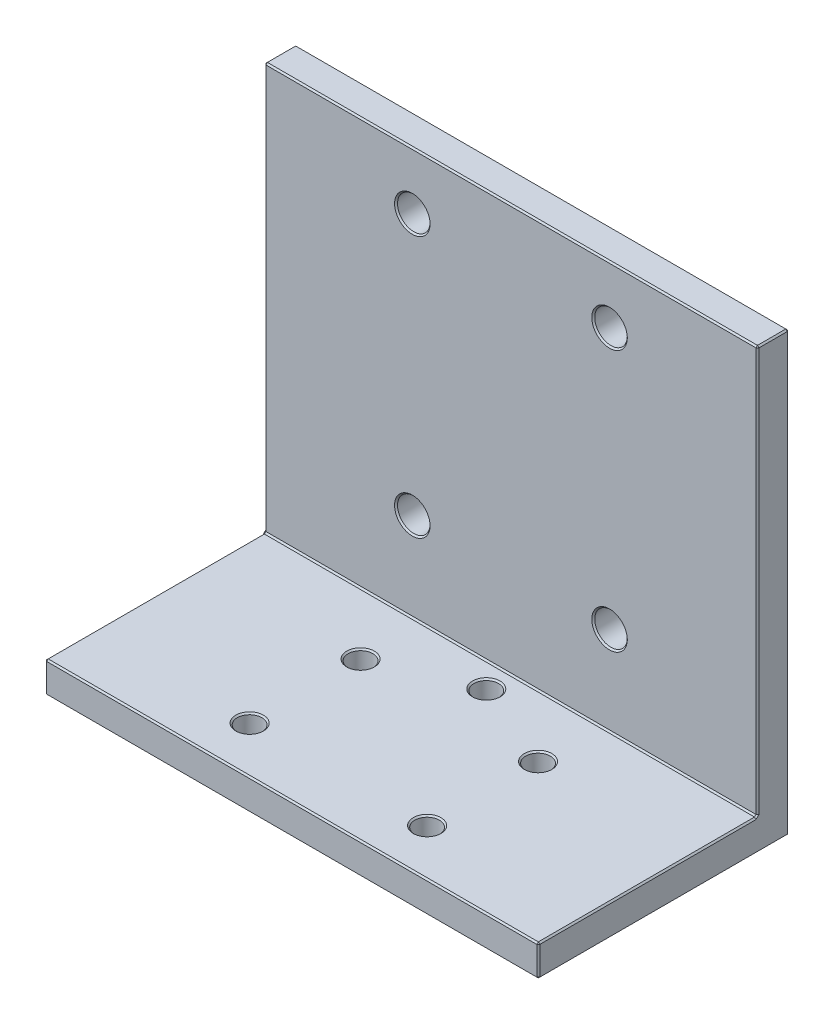
from build123d import *

# Parameters (mm, degrees)
BOSS_EXTRUDE1_DEPTH = 50
SKETCH2_R           = 3.3
CUT_EXTRUDE1_DEPTH  = 100
SKETCH3_R           = 2.5
CUT_EXTRUDE2_DEPTH  = 100
CHAMFER1_SIZE       = 0.3


with BuildPart() as part:
    # Sketch1 → Boss-Extrude1 (new, symmetric)
    with BuildSketch(Plane(origin=(0, 0, 0), x_dir=(0, 0, -1), z_dir=(1, 0, 0))):
        Polygon((0, 0), (0, 88.9), (-6.35, 88.9), (-6.35, 6.35), (-50.8, 6.35), (-50.8, 0), align=None)
    extrude(amount=BOSS_EXTRUDE1_DEPTH, both=True)

    # Sketch2 → Cut-Extrude1 (cut)
    with BuildSketch(Plane.XY.offset(6.35)):
        with Locations((-20, 77.3)):
            Circle(SKETCH2_R)
        with Locations((20, 77.3)):
            Circle(SKETCH2_R)
        with Locations((20, 24.3)):
            Circle(SKETCH2_R)
        with Locations((-20, 24.3)):
            Circle(SKETCH2_R)
    extrude(amount=-CUT_EXTRUDE1_DEPTH, mode=Mode.SUBTRACT)

    # Sketch3 → Cut-Extrude2 (cut)
    with BuildSketch(Plane(origin=(0, 6.35, 0), x_dir=(1, 0, 0), z_dir=(0, 1, 0))):
        with Locations((-18, -18.85)):
            Circle(SKETCH3_R)
        with Locations((-18, -41.35)):
            Circle(SKETCH3_R)
        with Locations((18, -41.35)):
            Circle(SKETCH3_R)
        with Locations((18, -18.85)):
            Circle(SKETCH3_R)
        with Locations((0, -11.35)):
            Circle(SKETCH3_R)
    extrude(amount=-CUT_EXTRUDE2_DEPTH, mode=Mode.SUBTRACT)

    # Chamfer1
    chamfer1_edges = [part.edges().sort_by_distance(p)[0] for p in [
        (-20.5, 6.35, 18.85),
        (-20.5, 6.35, 41.35),
        (15.5, 6.35, 41.35),
        (15.5, 6.35, 18.85),
        (-2.5, 6.35, 11.35),
        (-23.3, 77.3, 6.35),
        (16.7, 77.3, 6.35),
        (16.7, 24.3, 6.35),
        (-23.3, 24.3, 6.35),
        (50, 6.35, 28.575),
        (0, 6.35, 50.8),
        (-50, 6.35, 28.575),
        (0, 88.9, 6.35),
        (50, 47.625, 6.35),
        (0, 6.35, 6.35),
        (-50, 47.625, 6.35),
        (0, 0, 0),
        (0, 88.9, 0),
        (50, 3.175, 50.8),
        (50, 88.9, 3.175),
        (50, 44.45, 0),
        (50, 0, 25.4),
        (0, 0, 50.8),
        (-50, 3.175, 50.8),
        (-50, 88.9, 3.175),
        (-50, 44.45, 0),
        (-50, 0, 25.4),
        (-23.3, 77.3, 0),
        (16.7, 77.3, 0),
        (16.7, 24.3, 0),
        (-23.3, 24.3, 0),
        (-20.5, 0, 18.85),
        (-20.5, 0, 41.35),
        (15.5, 0, 41.35),
        (15.5, 0, 18.85),
        (-2.5, 0, 11.35),
    ]]
    chamfer(chamfer1_edges, length=CHAMFER1_SIZE)


solid = part.part
